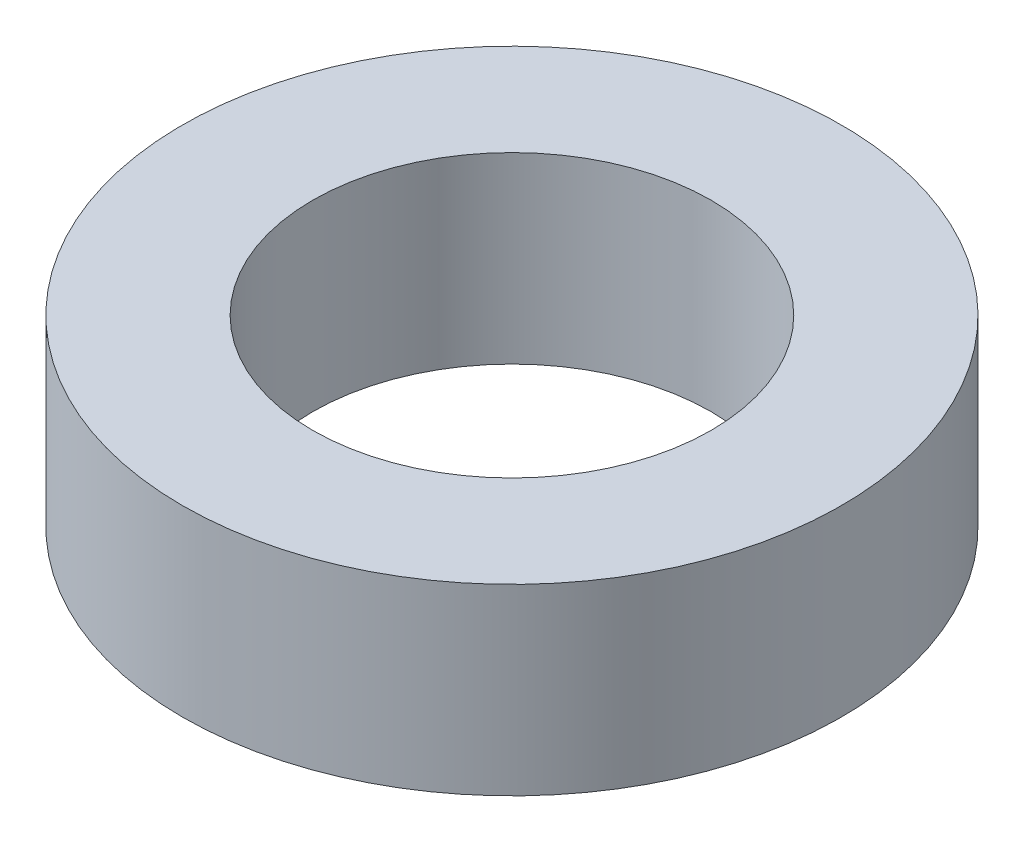
from build123d import *

# Parameters (mm, degrees)
SKETCH1_R           = 5.3975
SKETCH1_R_2         = 3.2639
BOSS_EXTRUDE1_DEPTH = 3


with BuildPart() as part:
    # Sketch1 → Boss-Extrude1 (new body)
    with BuildSketch(Plane(origin=(0, 0, 0), x_dir=(1, 0, 0), z_dir=(0, 1, 0))):
        Circle(SKETCH1_R)
        Circle(SKETCH1_R_2, mode=Mode.SUBTRACT)
    extrude(amount=BOSS_EXTRUDE1_DEPTH)


solid = part.part
